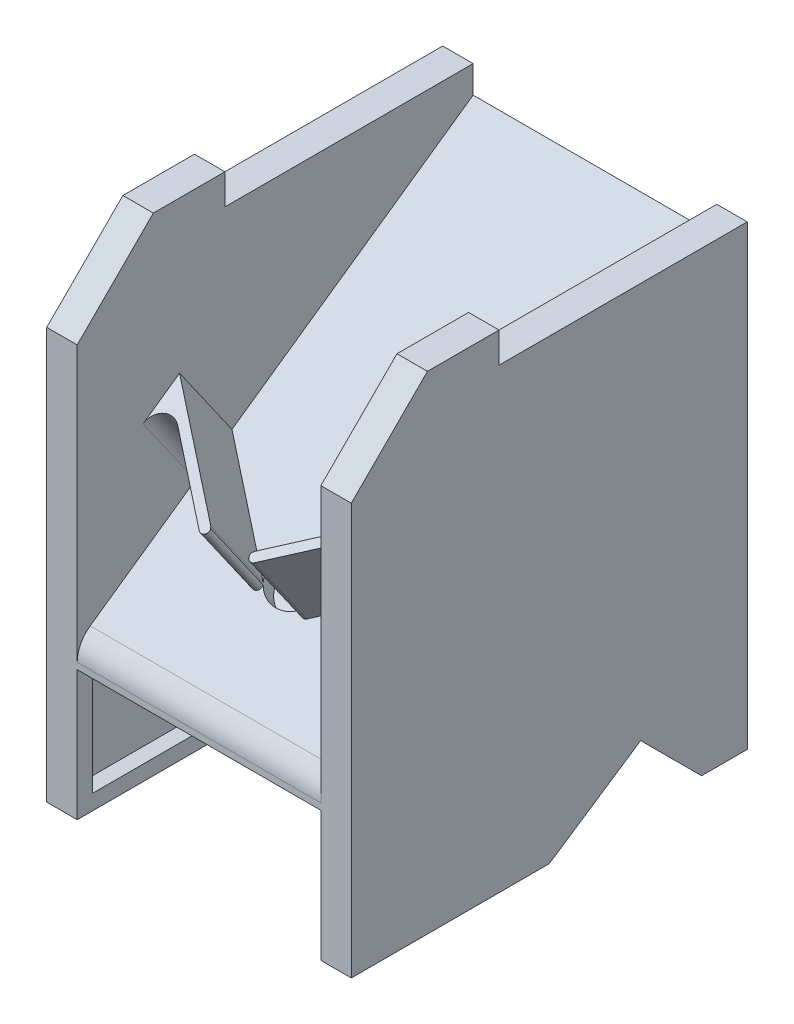
from build123d import *
from build123d.topology import SkipClean

# Parameters (mm, degrees)
SKETCH5_W           = 100
SKETCH5_H           = 130
BOSS_EXTRUDE1_DEPTH = 150
CUT_EXTRUDE1_START  = -50
CUT_EXTRUDE1_DEPTH  = 40
BOSS_EXTRUDE3_START = 30
SKETCH17_W          = 80
SKETCH17_H          = 40
BOSS_EXTRUDE3_DEPTH = 5
SKETCH10_R          = 8.75
CUT_EXTRUDE3_DEPTH  = 100
SKETCH18_W          = 48.5
SKETCH18_H          = 10
BOSS_EXTRUDE4_DEPTH = 10
BOSS_EXTRUDE5_START = 100
SKETCH18_2_W        = 48.5
SKETCH18_2_H        = 10
BOSS_EXTRUDE5_DEPTH = 10
CUT_EXTRUDE5_DEPTH  = 70
FILLET1_DEPTH       = 10
CUT_EXTRUDE6_DEPTH  = 120
FILLET2_R           = 10
CHAMFER2_SIZE       = 25
BOSS_EXTRUDE6_START = 30
BOSS_EXTRUDE6_DEPTH = 30
FILLET3_R           = 5
CUT_EXTRUDE7_DEPTH  = 5


with BuildPart() as part:
    # Sketch5 → Boss-Extrude1 (new body)
    with BuildSketch(Plane(origin=(0, 0, 0), x_dir=(1, 0, 0), z_dir=(0, 1, 0))):
        with Locations((50, 65)):
            Rectangle(SKETCH5_W, SKETCH5_H)
    extrude(amount=BOSS_EXTRUDE1_DEPTH)

    # Sketch7 → Cut-Extrude1 (cut, symmetric)
    with BuildSketch(Plane(origin=(100, 0, 0), x_dir=(0, 0, -1), z_dir=(1, 0, 0)).offset(CUT_EXTRUDE1_START)):
        Polygon((130, 0), (130, 133.702332435), (0, 42.675352467), (0, 0), align=None)
        Polygon((0, 50), (130, 141.026979967), (130, 150), (0, 150), align=None)
    extrude(amount=CUT_EXTRUDE1_DEPTH, both=True, mode=Mode.SUBTRACT)

    # Sketch17 → Boss-Extrude3 (add)
    with BuildSketch(Plane(origin=(0, 275.412054826, -321.921776796), x_dir=(1, 0, 0), z_dir=(0, -0.819152044288993, -0.5735764363510444)).offset(BOSS_EXTRUDE3_START)):
        with Locations((50, 354.293228142)):
            Rectangle(SKETCH17_W, SKETCH17_H)
    extrude(amount=-BOSS_EXTRUDE3_DEPTH)

    # Sketch10 → Cut-Extrude3 (cut)
    with BuildSketch(Plane(origin=(0, 33.550503583, 23.49231552), x_dir=(1, 0, 0), z_dir=(0, 0.819152044288993, 0.5735764363510444))):
        with Locations(Location((50, 68.178273127, 0), (0, 0, 90))):
            Circle(SKETCH10_R)
    extrude(amount=-CUT_EXTRUDE3_DEPTH, mode=Mode.SUBTRACT)

    # Sketch18 → Boss-Extrude4 (add)
    with BuildSketch(Plane(origin=(0, 0, 0), x_dir=(0, 0, -1), z_dir=(1, 0, 0))):
        with Locations((24.25, 155)):
            Rectangle(SKETCH18_W, SKETCH18_H)
    extrude(amount=BOSS_EXTRUDE4_DEPTH)

    # Sketch18<2> → Boss-Extrude5 (add)
    with BuildSketch(Plane(origin=(0, 0, 0), x_dir=(0, 0, -1), z_dir=(1, 0, 0)).offset(BOSS_EXTRUDE5_START)):
        with Locations((24.25, 155)):
            Rectangle(SKETCH18_2_W, SKETCH18_2_H)
    extrude(amount=-BOSS_EXTRUDE5_DEPTH)

    # Sketch21 → Cut-Extrude5 (cut)
    with BuildSketch(Plane(origin=(0, 0, 0), x_dir=(0, 0, -1), z_dir=(1, 0, 0))):
        Polygon((62.42420648, 63.190535225), (51.526254189, 78.754424066), (18.760172418, 55.811366612), (29.658124708, 40.247477771), align=None)
        Polygon((69.307123716, 53.360710693), (36.541041945, 30.417653239), (32.52600689, 36.151717549), (65.292088662, 59.094775003), align=None)
    extrude(amount=CUT_EXTRUDE5_DEPTH, mode=Mode.SUBTRACT)

    # Fillet1: read off the stored shape, not the designer's step
    # Fillet1 outline → Fillet1 (add)
    with BuildSketch(Plane.YZ):
        with BuildLine():
            Line((30.417653239, -36.541041945), (33.285535421, -40.636802166))
            ThreePointArc((33.285535421, -40.636802166), (32.457256878, -36.900679096), (34.513413461, -33.673159763))
            Line((34.513413461, -33.673159763), (30.417653239, -36.541041945))
        make_face()
        with BuildLine():
            ThreePointArc((43.115359953, -33.75388493), (42.287081409, -30.01776186), (44.343237992, -26.790242527))
            Line((44.343237992, -26.790242527), (40.247477771, -29.658124708))
            Line((40.247477771, -29.658124708), (43.115359953, -33.75388493))
        make_face()
    extrude(amount=FILLET1_DEPTH)

    # Sketch22 → Cut-Extrude6 (cut)
    with BuildSketch(Plane.ZY):
        Polygon((-115, 0), (-95, 20), (-65, 0), align=None)
    extrude(amount=-CUT_EXTRUDE6_DEPTH, mode=Mode.SUBTRACT)

    # Fillet2
    fillet2_edges = [part.edges().sort_by_distance(p)[0] for p in [
        (50, 50, 0),
    ]]
    fillet(fillet2_edges, radius=FILLET2_R)

    # Chamfer2
    chamfer2_edges = [part.edges().sort_by_distance(p)[0] for p in [
        (5, 160, 0),
        (95, 160, 0),
    ]]
    chamfer(chamfer2_edges, length=CHAMFER2_SIZE)

    # Sketch23 → Boss-Extrude6 (add)
    with SkipClean():  # the faces are left unmerged after this step: merging them gives an invalid solid
        with BuildSketch(Plane(origin=(0, 33.550503583, 23.49231552), x_dir=(1, 0, 0), z_dir=(0, 0.819152044288993, 0.5735764363510444)).offset(BOSS_EXTRUDE6_START)):
            with BuildLine():
                Line((90, 90.716932877), (57.180703308, 63.178273127))
                ThreePointArc((57.180703308, 63.178273127), (56.983337112, 62.906129088), (56.77566264, 62.64176739))
                ThreePointArc((56.77566264, 62.64176739), (57.241088602, 60.832062958), (59.109066137, 60.880139798))
                Line((59.109066137, 60.880139798), (90, 86.800711009))
                Line((90, 86.800711009), (90, 90.716932877))
            make_face()
            with BuildLine():
                ThreePointArc((40.890933863, 60.880139798), (42.758911398, 60.832062958), (43.22433736, 62.64176739))
                ThreePointArc((43.22433736, 62.64176739), (43.016662888, 62.906129088), (42.819296692, 63.178273127))
                Line((42.819296692, 63.178273127), (10, 90.716932877))
                Line((10, 90.716932877), (10, 86.800711009))
                Line((10, 86.800711009), (40.890933863, 60.880139798))
            make_face()
        extrude(amount=-BOSS_EXTRUDE6_DEPTH)

    # Fillet3
    fillet3_edges = [part.edges().sort_by_distance(p)[0] for p in [
        (90, 95.624626741, -39.007017804),
        (10, 95.624626741, -39.007017804),
    ]]
    fillet(fillet3_edges, radius=FILLET3_R)

    # Sketch24 → Cut-Extrude7 (cut)
    with SkipClean():  # the faces are left unmerged after this step: merging them gives an invalid solid
        with BuildSketch(Plane(origin=(10, 0, 0), x_dir=(0, 0, -1), z_dir=(1, 0, 0))):
            with BuildLine():
                ThreePointArc((29.577399541, 31.645531279), (36.032438208, 27.533218113), (43.504684348, 29.1897752))
                Line((43.504684348, 29.1897752), (76.270766119, 52.132832654))
                Line((76.270766119, 52.132832654), (69.387848883, 61.962657185))
                Line((69.387848883, 61.962657185), (66.519966701, 66.058417407))
                Line((66.519966701, 66.058417407), (58.489896592, 77.526546027))
                Line((58.489896592, 77.526546027), (125, 124.0974218))
                Line((125, 124.0974218), (125, 5))
                Line((125, 5), (117.071067812, 5))
                Line((117.071067812, 5), (95.637089412, 26.4339784))
                Line((95.637089412, 26.4339784), (63.486121811, 5))
                Line((63.486121811, 5), (5, 5))
                Line((5, 5), (5, 40.072517215))
                Line((5, 40.072517215), (17.532294378, 48.847724209))
                Line((17.532294378, 48.847724209), (22.694482305, 41.475355811))
                Line((22.694482305, 41.475355811), (25.562364487, 37.379595589))
                Line((25.562364487, 37.379595589), (28.430246669, 33.283835368))
                Line((28.430246669, 33.283835368), (29.577399541, 31.645531279))
            make_face()
        cut_extrude7 = extrude(amount=-CUT_EXTRUDE7_DEPTH, mode=Mode.SUBTRACT)

    # Mirror1: Cut-Extrude7 across plane
    with SkipClean():  # the faces are left unmerged after this step: merging them gives an invalid solid
        add(cut_extrude7.mirror(Plane.ZY.offset(-50)), mode=Mode.SUBTRACT)


solid = part.part
